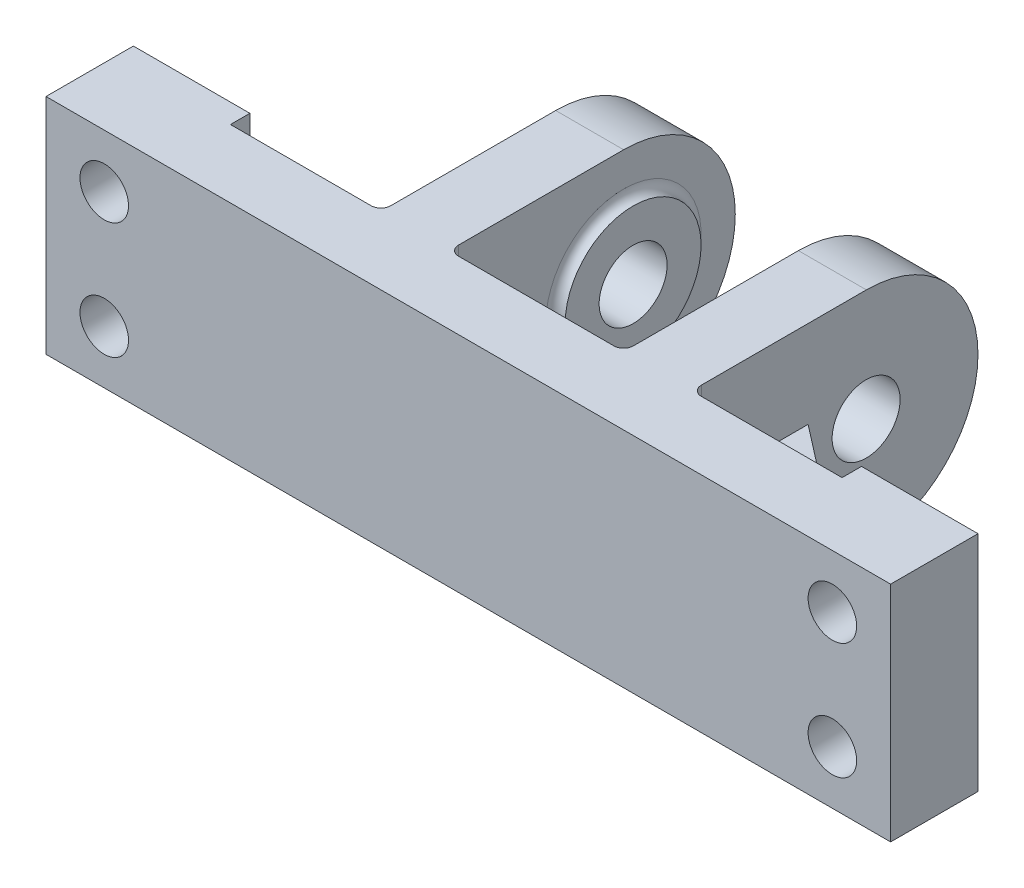
from build123d import *

# Parameters (mm, degrees)
SKETCH1_W           = 174
SKETCH1_H           = 46
BOSS_EXTRUDE1_DEPTH = 18
SKETCH2_W           = 126
SKETCH2_H           = 46
CUT_EXTRUDE1_DEPTH  = 4
SKETCH3_R           = 5
CUT_EXTRUDE2_DEPTH  = 92.771455257
BOSS_EXTRUDE3_DEPTH = 14
SKETCH6_R           = 14
BOSS_EXTRUDE5_DEPTH = 2
CUT_EXTRUDE3_REACH  = 121.008
SKETCH7_R           = 7
BOSS_EXTRUDE7_DEPTH = 5
FILLET1_R           = 2
FILLET2_R           = 2


with BuildPart() as part:
    # Sketch1 → Boss-Extrude1 (new body)
    with BuildSketch(Plane.XY):
        Rectangle(SKETCH1_W, SKETCH1_H)
    extrude(amount=BOSS_EXTRUDE1_DEPTH)

    # Sketch2 → Cut-Extrude1 (cut)
    with BuildSketch(Plane(origin=(0, 0, 0), x_dir=(-1, 0, 0), z_dir=(0, 0, -1))):
        Rectangle(SKETCH2_W, SKETCH2_H)
    extrude(amount=-CUT_EXTRUDE1_DEPTH, mode=Mode.SUBTRACT)

    # Sketch3 → Cut-Extrude2 (cut, through all)
    with BuildSketch(Plane(origin=(0, 0, 0), x_dir=(-1, 0, 0), z_dir=(0, 0, -1))):
        with Locations((75, 12)):
            Circle(SKETCH3_R)
        with Locations(Location((75, -12, 0), (0, 0, 180))):
            Circle(SKETCH3_R)
        with Locations((-75, -12)):
            Circle(SKETCH3_R)
        with Locations(Location((-75, 12, 0), (0, 0, 180))):
            Circle(SKETCH3_R)
    extrude(amount=-CUT_EXTRUDE2_DEPTH, mode=Mode.SUBTRACT)

    # Sketch4 → Boss-Extrude3 (add)
    with BuildSketch(Plane.ZY.offset(32)):
        with BuildLine():
            Line((4, 23), (-32, 23))
            ThreePointArc((-32, 23), (-55, 0), (-32, -23))
            Line((-32, -23), (4, -23))
            Line((4, -23), (4, 23))
        make_face()
    boss_extrude3 = extrude(amount=-BOSS_EXTRUDE3_DEPTH)

    # Sketch6 → Boss-Extrude5 (add)
    with BuildSketch(Plane(origin=(-18, 0, 0), x_dir=(0, 0, -1), z_dir=(1, 0, 0))):
        with Locations(Location((31.952757206, 0, 0), (0, 0, 180))):
            Circle(SKETCH6_R)
    boss_extrude5 = extrude(amount=BOSS_EXTRUDE5_DEPTH)

    # Sketch7 → Cut-Extrude3 (cut, up to next)
    with BuildSketch(Plane(origin=(-16, 0, 0), x_dir=(0, 0, -1), z_dir=(1, 0, 0)), mode=Mode.PRIVATE) as cut_extrude3_sk1:
        with Locations((31.952757206, 0)):
            Circle(SKETCH7_R)
    cut_extrude3_tool1 = extrude(cut_extrude3_sk1.sketch, amount=-CUT_EXTRUDE3_REACH, mode=Mode.PRIVATE) & part.part
    cut_extrude3 = cut_extrude3_tool1.solids().sort_by_distance((-16, 0, -31.952757))[0]
    add(cut_extrude3, mode=Mode.SUBTRACT)

    # Sketch9 → Boss-Extrude7 (add, symmetric)
    with BuildSketch(Plane(origin=(0, 0, 0), x_dir=(1, 0, 0), z_dir=(0, 1, 0))):
        Polygon((-32, 20), (-63, -4), (-32, -4), align=None)
    boss_extrude7 = extrude(amount=BOSS_EXTRUDE7_DEPTH, both=True)

    # Mirror1: Boss-Extrude3, Boss-Extrude5, Cut-Extrude3, Boss-Extrude7 across plane
    add(boss_extrude3.mirror(Plane(origin=(0, 0, 0), x_dir=(0, 0, 1), z_dir=(1, 0, 0))))
    add(boss_extrude5.mirror(Plane(origin=(0, 0, 0), x_dir=(0, 0, 1), z_dir=(1, 0, 0))))
    add(cut_extrude3.mirror(Plane(origin=(0, 0, 0), x_dir=(0, 0, 1), z_dir=(1, 0, 0))), mode=Mode.SUBTRACT)
    add(boss_extrude7.mirror(Plane(origin=(0, 0, 0), x_dir=(0, 0, 1), z_dir=(1, 0, 0))))

    # Fillet1
    fillet1_edges = [part.edges().sort_by_distance(p)[0] for p in [
        (32, 14, 4),
        (-18, 0, 4),
        (-32, -14, 4),
        (-32, 14, 4),
        (32, -14, 4),
        (18, 0, 4),
    ]]
    fillet(fillet1_edges, radius=FILLET1_R)

    # Fillet2
    fillet2_edges = [part.edges().sort_by_distance(p)[0] for p in [
        (-18, 0, -45.952757206),
        (18, 0, -45.952757206),
    ]]
    fillet(fillet2_edges, radius=FILLET2_R - 0.0001)  # a hair under: the kernel refuses the full size


solid = part.part
